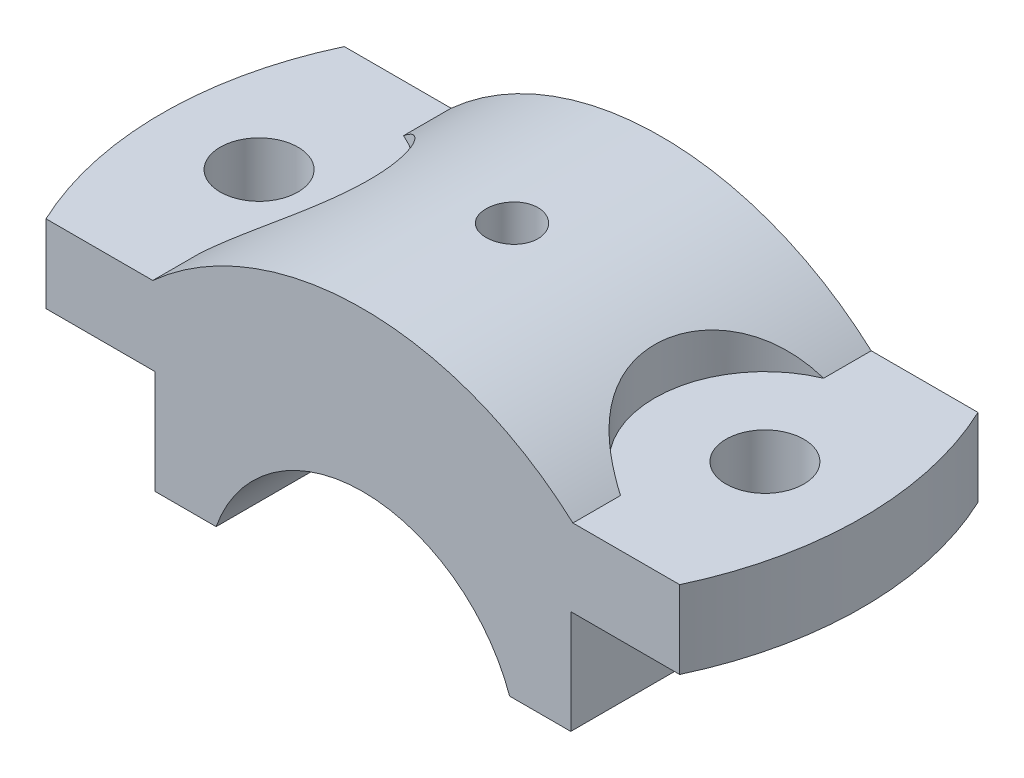
from build123d import *

# Parameters (mm, degrees)
BOSS_EXTRUDE1_DEPTH = 23
SKETCH2_R           = 17
CUT_EXTRUDE1_DEPTH  = 66.030761952
SKETCH3_R           = 6
CUT_EXTRUDE2_DEPTH  = 66.030761987
CUT_EXTRUDE3_START  = -12
CUT_EXTRUDE3_DEPTH  = 12


# Read off the part's stored shape, not the designer's step: Cut-Extrude3
with BuildPart() as part:
    # Sketch1 → Boss-Extrude1 (new, symmetric)
    with BuildSketch(Plane.XY):
        with BuildLine():
            Line((-32.062618722, 8), (-22.627416998, 8))
            ThreePointArc((-22.627416998, 8), (0, 24), (22.627416998, 8))
            Line((22.627416998, 8), (32.062618722, 8))
            Line((32.062618722, 8), (32.062618722, 24))
            Line((32.062618722, 24), (54, 24))
            Line((54, 24), (54, 36))
            Line((54, 36), (32.391338275, 36))
            ThreePointArc((32.391338275, 36), (0, 48.427252609), (-32.391338275, 36))
            Line((-32.391338275, 36), (-54, 36))
            Line((-54, 36), (-54, 24))
            Line((-54, 24), (-32.062618722, 24))
            Line((-32.062618722, 24), (-32.062618722, 8))
        make_face()
    extrude(amount=BOSS_EXTRUDE1_DEPTH, both=True)

    # Sketch2 → Cut-Extrude1 (cut, through all)
    with BuildSketch(Plane(origin=(0, 36, 0), x_dir=(1, 0, 0), z_dir=(0, 1, 0))):
        with Locations((-39, 0)):
            Circle(SKETCH2_R)
        with Locations((39, 0)):
            Circle(SKETCH2_R)
    extrude(amount=CUT_EXTRUDE1_DEPTH, mode=Mode.SUBTRACT)

    # Sketch3 → Cut-Extrude2 (cut, through all)
    with BuildSketch(Plane(origin=(0, 36, 0), x_dir=(1, 0, 0), z_dir=(0, 1, 0))):
        with Locations(Location((-39, 0, 0), (0, 0, 270))):
            Circle(SKETCH3_R)
        with Locations(Location((39, 0, 0), (0, 0, 270))):
            Circle(SKETCH3_R)
    extrude(amount=-CUT_EXTRUDE2_DEPTH, mode=Mode.SUBTRACT)

    # Sketch4 → Cut-Revolve1 (revolve, cut)
    with BuildSketch(Plane.XY, mode=Mode.PRIVATE) as cut_revolve1_sk:
        Polygon((0, 50), (4, 50), (4, 33), (3, 33), (3, 20), (0, 20), align=None)
    revolve(cut_revolve1_sk.sketch.rotate(Axis((0, 50, 0), (0, -1, 0)), 180), axis=Axis((0, 50, 0), (0, -1, 0)), mode=Mode.SUBTRACT)

    # Cut-Extrude3 outline → Cut-Extrude3 (cut)
    with BuildSketch(Plane(origin=(0, 36, 0), x_dir=(1, 0, 0), z_dir=(0, 1, 0)).offset(CUT_EXTRUDE3_START)):
        with BuildLine():
            ThreePointArc((-54, 0), (-52.698550436, 11.784005345), (-48.856934001, 23))
            Line((-48.856934001, 23), (-54, 23))
            Line((-54, 23), (-54, 0))
        make_face()
        with BuildLine():
            ThreePointArc((-48.856934001, -23), (-52.698550436, -11.784005345), (-54, 0))
            Line((-54, 0), (-54, -23))
            Line((-54, -23), (-48.856934001, -23))
        make_face()
        with BuildLine():
            Line((54, 23), (48.856934001, 23))
            ThreePointArc((48.856934001, 23), (52.698550436, 11.784005345), (54, 0))
            Line((54, 0), (54, 23))
        make_face()
        with BuildLine():
            Line((54, -23), (54, 0))
            ThreePointArc((54, 0), (52.698550436, -11.784005345), (48.856934001, -23))
            Line((48.856934001, -23), (54, -23))
        make_face()
    extrude(amount=CUT_EXTRUDE3_DEPTH, mode=Mode.SUBTRACT)


solid = part.part
